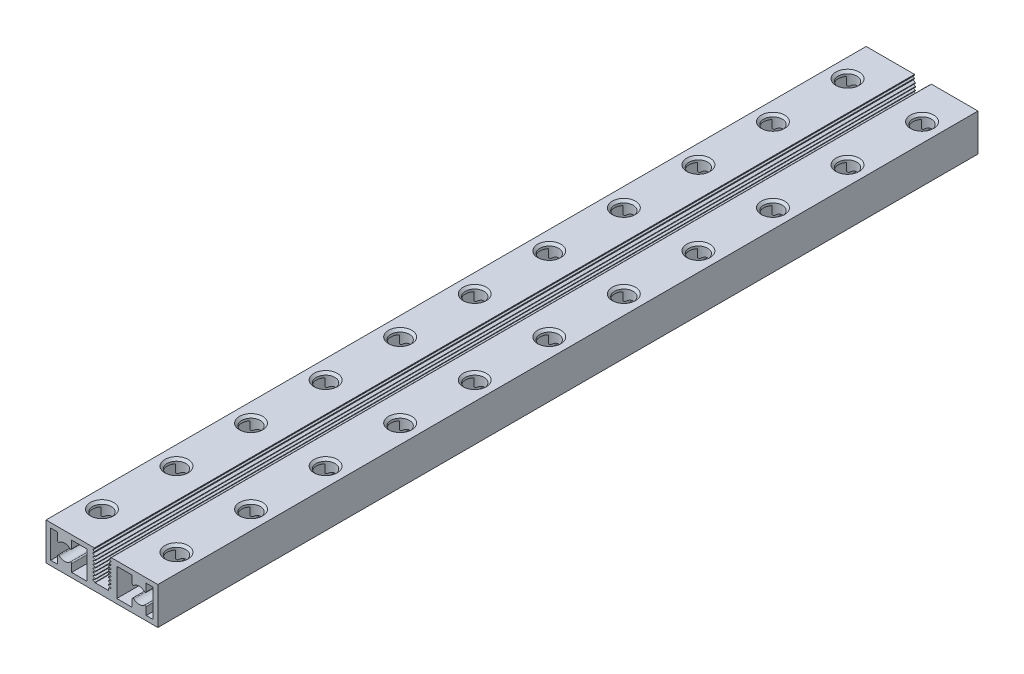
from build123d import *
from OCP.BRepFilletAPI import BRepFilletAPI_MakeChamfer

# Parameters (mm, degrees)
SKETCH1_W                    = 24
SKETCH1_H                    = 176
BOSS_EXTRUDE1_DEPTH          = 8
CUT_EXTRUDE1_DEPTH           = 177.589920437
CUT_EXTRUDE2_DEPTH           = 177.589920437
CUT_EXTRUDE3_DEPTH           = 177.589920437
F_4_0_4_DIAMETER_HOLE1_D     = 4
F_4_0_4_DIAMETER_HOLE1_DEPTH = 10.814359354
CHAMFER1_SIZE                = 0.5
CHAMFER2_SIZE                = 0.175
CHAMFER2_SIZE2               = 0.163456735
CHAMFER3_SIZE                = 0.168999185
CHAMFER3_SIZE2               = 0.180933856


with BuildPart() as part:
    # Sketch1 → Boss-Extrude1 (new body)
    with BuildSketch(Plane(origin=(0, 8, 0), x_dir=(1, 0, 0), z_dir=(0, 1, 0))):
        with Locations((0, -88)):
            Rectangle(SKETCH1_W, SKETCH1_H)
    extrude(amount=-BOSS_EXTRUDE1_DEPTH)

    # Sketch2 → Cut-Extrude1 (cut, through all)
    with BuildSketch(Plane.XY.offset(176)):
        Polygon((2, 8), (-1.62, 8), (-1.62, 7.825), (-2.074663337, 7.5625), (-1.468445554, 7.2125), (-2.087849868, 6.854886753), (-1.240412917, 6.5125), (-2.106693316, 6.1625), (-1.240412917, 5.8125), (-2.106693316, 5.4625), (-1.240412917, 5.1125), (-2.106693316, 4.7625), (-1.240412917, 4.4125), (-2.106693316, 4.0625), (-1.240412917, 3.7125), (-2.106693316, 3.3625), (-1.240412917, 3.0125), (-2.106693316, 2.6625), (-1.240412917, 2.3125), (-2.106693316, 1.9625), (-1.46, 1.70121894), (-1.46, 1.6), (1.46, 1.6), (1.46, 2.061825838), (2.106693316, 2.323106898), (1.240412917, 2.673106898), (2.106693316, 3.023106898), (1.240412917, 3.373106898), (2.106693316, 3.723106898), (1.240412917, 4.073106898), (2.106693316, 4.423106898), (1.240412917, 4.773106898), (2.106693316, 5.123106898), (1.240412917, 5.473106898), (2.106693316, 5.823106898), (1.240412917, 6.173106898), (2.087849868, 6.515493651), (1.468445554, 6.873106898), (2.074663337, 7.223106898), (1.468445554, 7.573106898), (2, 7.88), align=None)
    extrude(amount=-CUT_EXTRUDE1_DEPTH, mode=Mode.SUBTRACT)

    # Sketch3 → Cut-Extrude2 (cut, through all)
    with BuildSketch(Plane(origin=(0, 0, 0), x_dir=(-1, 0, 0), z_dir=(0, 0, -1))):
        with BuildLine():
            Line((-6.5, 2.614359354), (-6.5, 1))
            Line((-6.5, 1), (-3.2, 1))
            Line((-3.2, 1), (-3.2, 7))
            Line((-3.2, 7), (-6.5, 7))
            Line((-6.5, 7), (-6.5, 5.385640646))
            ThreePointArc((-6.5, 5.385640646), (-6.620528059, 5.202108059), (-6.836842105, 5.239783736))
            ThreePointArc((-6.836842105, 5.239783736), (-8, 5.7), (-9.163157895, 5.239783736))
            ThreePointArc((-9.163157895, 5.239783736), (-9.379471941, 5.202108059), (-9.5, 5.385640646))
            Line((-9.5, 5.385640646), (-9.5, 7))
            Line((-9.5, 7), (-11, 7))
            Line((-11, 7), (-11, 1))
            Line((-11, 1), (-9.5, 1))
            Line((-9.5, 1), (-9.5, 2.614359354))
            ThreePointArc((-9.5, 2.614359354), (-9.379471941, 2.797891941), (-9.163157895, 2.760216264))
            ThreePointArc((-9.163157895, 2.760216264), (-8, 2.3), (-6.836842105, 2.760216264))
            ThreePointArc((-6.836842105, 2.760216264), (-6.620528059, 2.797891941), (-6.5, 2.614359354))
        make_face()
    extrude(amount=-CUT_EXTRUDE2_DEPTH, mode=Mode.SUBTRACT)

    # Sketch4 → Cut-Extrude3 (cut, through all)
    with BuildSketch(Plane.XY.offset(176)):
        with BuildLine():
            Line((-9.5, 7), (-11, 7))
            Line((-11, 7), (-11, 1))
            Line((-11, 1), (-9.5, 1))
            Line((-9.5, 1), (-9.5, 2.614359354))
            ThreePointArc((-9.5, 2.614359354), (-9.379471941, 2.797891941), (-9.163157895, 2.760216264))
            ThreePointArc((-9.163157895, 2.760216264), (-8, 2.3), (-6.836842105, 2.760216264))
            ThreePointArc((-6.836842105, 2.760216264), (-6.620528059, 2.797891941), (-6.5, 2.614359354))
            Line((-6.5, 2.614359354), (-6.5, 1))
            Line((-6.5, 1), (-3.2, 1))
            Line((-3.2, 1), (-3.2, 7))
            Line((-3.2, 7), (-6.5, 7))
            Line((-6.5, 7), (-6.5, 5.385640646))
            ThreePointArc((-6.5, 5.385640646), (-6.620528059, 5.202108059), (-6.836842105, 5.239783736))
            ThreePointArc((-6.836842105, 5.239783736), (-8, 5.7), (-9.163157895, 5.239783736))
            ThreePointArc((-9.163157895, 5.239783736), (-9.379471941, 5.202108059), (-9.5, 5.385640646))
            Line((-9.5, 5.385640646), (-9.5, 7))
        make_face()
    extrude(amount=-CUT_EXTRUDE3_DEPTH, mode=Mode.SUBTRACT)

    # Ø4.0 (4) Diameter Hole1
    with Locations(Plane(origin=(0, 8, 0), x_dir=(1, 0, 0), z_dir=(0, 1, 0))):
        with Locations((-8, -152), (-8, -168), (-8, -136), (-8, -120), (-8, -104), (-8, -88), (-8, -72), (-8, -56), (-8, -40), (-8, -24), (-8, -8), (8, -8), (8, -24), (8, -40), (8, -56), (8, -72), (8, -88), (8, -104), (8, -120), (8, -136), (8, -152), (8, -168)):
            Hole(F_4_0_4_DIAMETER_HOLE1_D / 2, depth=F_4_0_4_DIAMETER_HOLE1_DEPTH)

    # Chamfer1
    chamfer1_edges = [part.edges().sort_by_distance(p)[0] for p in [
        (-6, 0, 8),
        (-6, 8, 8),
        (-6, 0, 24),
        (-6, 8, 24),
        (-6, 0, 40),
        (-6, 8, 40),
        (-6, 0, 56),
        (-6, 8, 56),
        (-6, 0, 72),
        (-6, 8, 72),
        (-6, 0, 88),
        (-6, 8, 88),
        (-6, 0, 104),
        (-6, 8, 104),
        (-6, 0, 120),
        (-6, 8, 120),
        (-6, 0, 136),
        (-6, 8, 136),
        (-6, 0, 168),
        (-6, 8, 168),
        (-6, 0, 152),
        (-6, 8, 152),
        (10, 0, 168),
        (10, 8, 168),
        (10, 0, 152),
        (10, 8, 152),
        (10, 0, 136),
        (10, 8, 136),
        (10, 0, 120),
        (10, 8, 120),
        (10, 0, 104),
        (10, 8, 104),
        (10, 0, 88),
        (10, 8, 88),
        (10, 0, 72),
        (10, 8, 72),
        (10, 0, 56),
        (10, 8, 56),
        (10, 0, 40),
        (10, 8, 40),
        (10, 0, 24),
        (10, 8, 24),
        (10, 0, 8),
        (10, 8, 8),
    ]]
    chamfer(chamfer1_edges, length=CHAMFER1_SIZE)

    # Chamfer2: one chamfer whose edges measure the first distance from different faces: ONE call of the kernel's chamfer builder (chamfer() names one face for all edges)
    chamfer2_edges_1 = [part.edges().sort_by_distance(p)[0] for p in [
        (1.468445554, 7.573106898, 88),
        (2.074663337, 7.223106898, 88),
        (1.468445554, 6.873106898, 88),
        (-1.468445554, 7.2125, 88),
        (-2.074663337, 7.5625, 88),
    ]]
    chamfer2_edges_2 = [part.edges().sort_by_distance(p)[0] for p in [
        (2.087849868, 6.515493651, 88),
    ]]
    chamfer2_side_2 = [part.faces().sort_by_distance(p)[0] for p in [
        (1.778147711, 6.694300274, 88),
    ]]
    chamfer2 = BRepFilletAPI_MakeChamfer(part.part.solid().wrapped)
    for e in chamfer2_edges_1:
        chamfer2.Add(CHAMFER2_SIZE, e.wrapped)
    for e in chamfer2_edges_2:
        chamfer2.Add(CHAMFER2_SIZE, CHAMFER2_SIZE2, e.wrapped, chamfer2_side_2[0].wrapped)  # the first distance lies on this face
    add(Compound.cast(chamfer2.Shape()), mode=Mode.REPLACE)

    # Chamfer3: one chamfer whose edges measure the first distance from different faces: ONE call of the kernel's chamfer builder (chamfer() names one face for all edges)
    chamfer3_edges_1 = [part.edges().sort_by_distance(p)[0] for p in [
        (1.240412917, 6.173106898, 88),
        (2.106693316, 5.823106898, 88),
        (1.240412917, 5.473106898, 88),
        (2.106693316, 5.123106898, 88),
        (1.240412917, 4.773106898, 88),
        (2.106693316, 4.423106898, 88),
        (1.240412917, 4.073106898, 88),
        (2.106693316, 3.723106898, 88),
        (1.240412917, 3.373106898, 88),
        (2.106693316, 3.023106898, 88),
        (1.240412917, 2.673106898, 88),
        (2.106693316, 2.323106898, 88),
        (-2.106693316, 1.9625, 88),
        (-1.240412917, 2.3125, 88),
        (-2.106693316, 2.6625, 88),
        (-1.240412917, 3.0125, 88),
        (-2.106693316, 3.3625, 88),
        (-1.240412917, 3.7125, 88),
        (-2.106693316, 4.0625, 88),
        (-1.240412917, 4.4125, 88),
        (-2.106693316, 4.7625, 88),
        (-1.240412917, 5.1125, 88),
        (-2.106693316, 5.4625, 88),
        (-1.240412917, 5.8125, 88),
        (-2.106693316, 6.1625, 88),
        (-1.240412917, 6.5125, 88),
    ]]
    chamfer3_edges_2 = [part.edges().sort_by_distance(p)[0] for p in [
        (-2.087849868, 6.854886753, 88),
    ]]
    chamfer3_side_2 = [part.faces().sort_by_distance(p)[0] for p in [
        (-1.664131392, 6.683693376, 88),
    ]]
    chamfer3 = BRepFilletAPI_MakeChamfer(part.part.solid().wrapped)
    for e in chamfer3_edges_1:
        chamfer3.Add(CHAMFER3_SIZE, e.wrapped)
    for e in chamfer3_edges_2:
        chamfer3.Add(CHAMFER3_SIZE, CHAMFER3_SIZE2, e.wrapped, chamfer3_side_2[0].wrapped)  # the first distance lies on this face
    add(Compound.cast(chamfer3.Shape()), mode=Mode.REPLACE)


solid = part.part
